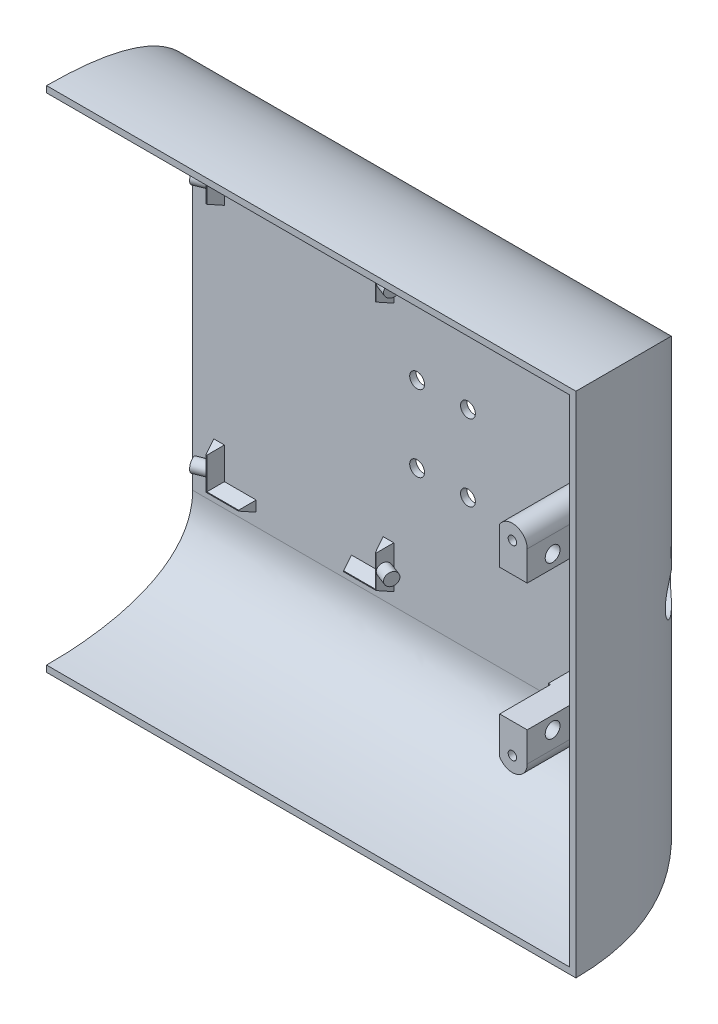
from build123d import *

# Parameters (mm, degrees)
BOSS_EXTRU_1_DEPTH           = 1.5
ENL_V_MAT_EXTRU_1_REACH      = 126.854
ESQUISSE3_R                  = 1.75
ESQUISSE4_W                  = 2.5
ESQUISSE4_H                  = 10
BOSS_EXTRU_2_DEPTH           = 3
BOSS_EXTRU_2_DRAFT           = -21
ESQUISSE4_W_2                = 10
ESQUISSE4_H_2                = 2.5
BOSS_EXTRU_2_PROFILE_2_DEPTH = 3
BOSS_EXTRU_2_PROFILE_2_DRAFT = -21
BOSS_EXTRU_2_PROFILE_3_DEPTH = 3
BOSS_EXTRU_2_PROFILE_3_DRAFT = -21
BOSS_EXTRU_2_PROFILE_4_DEPTH = 3
BOSS_EXTRU_2_PROFILE_4_DRAFT = -21
BOSS_EXTRU_2_PROFILE_5_DEPTH = 3
BOSS_EXTRU_2_PROFILE_5_DRAFT = -21
BOSS_EXTRU_2_PROFILE_6_DEPTH = 3
BOSS_EXTRU_2_PROFILE_6_DRAFT = -21
ENL_V_MAT_EXTRU_2_REACH      = 159.044
ESQUISSE8_R                  = 1
BOSS_EXTRU_3_REACH           = 159.044
ESQUISSE9_R                  = 1
ENL_V_MAT_EXTRU_3_DEPTH      = 12
ENL_V_MAT_EXTRU_4_REACH      = 148.818
ESQUISSE11_R                 = 1.75
BOSS_EXTRU_4_REACH           = 148.454
ESQUISSE16_W                 = 15
ESQUISSE16_H                 = 12
ENL_V_MAT_EXTRU_5_REACH      = 211.012
ESQUISSE12_R                 = 4.25
ESQUISSE17_W                 = 4
ESQUISSE17_H                 = 12
ENL_V_MAT_EXTRU_6_DEPTH      = 8
ESQUISSE20_R                 = 1.5
BOSS_EXTRU_5_DEPTH           = 3
ESQUISSE21_R                 = 1.5
BOSS_EXTRU_6_DEPTH           = 3


with BuildPart() as part:
    # Esquisse1 → Boss.-Extru.1 (new body)
    with BuildSketch(Plane.XY):
        Polygon((100.649081925, 73.864865318), (-4.350918075, 73.864865318), (-4.350918075, 33.864865318), (-4.350918075, -6.135134682), (100.649081925, -6.135134682), align=None)
    extrude(amount=BOSS_EXTRU_1_DEPTH)

    # Esquisse3 → Enlèv. mat.-Extru.1 (cut, up to next)
    with BuildSketch(Plane.XY.offset(1.5), mode=Mode.PRIVATE) as enl_v_mat_extru_1_sk1:
        with Locations((48.649081925, 42.864865318)):
            Circle(ESQUISSE3_R)
    enl_v_mat_extru_1_tool1 = extrude(enl_v_mat_extru_1_sk1.sketch, amount=-ENL_V_MAT_EXTRU_1_REACH, mode=Mode.PRIVATE) & part.part
    # Esquisse3 → Enlèv. mat.-Extru.1 (cut, up to next)
    with BuildSketch(Plane.XY.offset(1.5), mode=Mode.PRIVATE) as enl_v_mat_extru_1_sk2:
        with Locations((48.649081925, 24.864865318)):
            Circle(ESQUISSE3_R)
    enl_v_mat_extru_1_tool2 = extrude(enl_v_mat_extru_1_sk2.sketch, amount=-ENL_V_MAT_EXTRU_1_REACH, mode=Mode.PRIVATE) & part.part
    # Esquisse3 → Enlèv. mat.-Extru.1 (cut, up to next)
    with BuildSketch(Plane.XY.offset(1.5), mode=Mode.PRIVATE) as enl_v_mat_extru_1_sk3:
        with Locations((60.649081925, 24.864865318)):
            Circle(ESQUISSE3_R)
    enl_v_mat_extru_1_tool3 = extrude(enl_v_mat_extru_1_sk3.sketch, amount=-ENL_V_MAT_EXTRU_1_REACH, mode=Mode.PRIVATE) & part.part
    # Esquisse3 → Enlèv. mat.-Extru.1 (cut, up to next)
    with BuildSketch(Plane.XY.offset(1.5), mode=Mode.PRIVATE) as enl_v_mat_extru_1_sk4:
        with Locations((60.649081925, 42.864865318)):
            Circle(ESQUISSE3_R)
    enl_v_mat_extru_1_tool4 = extrude(enl_v_mat_extru_1_sk4.sketch, amount=-ENL_V_MAT_EXTRU_1_REACH, mode=Mode.PRIVATE) & part.part
    add(enl_v_mat_extru_1_tool1.solids().sort_by_distance((48.649082, 42.864865, 1.5))[0], mode=Mode.SUBTRACT)
    add(enl_v_mat_extru_1_tool2.solids().sort_by_distance((48.649082, 24.864865, 1.5))[0], mode=Mode.SUBTRACT)
    add(enl_v_mat_extru_1_tool3.solids().sort_by_distance((60.649082, 24.864865, 1.5))[0], mode=Mode.SUBTRACT)
    add(enl_v_mat_extru_1_tool4.solids().sort_by_distance((60.649082, 42.864865, 1.5))[0], mode=Mode.SUBTRACT)


with BuildPart() as boss_extru_2_tool:
    # Esquisse4 → Boss.-Extru.2 (with draft: the straight prism first)
    with BuildSketch(Plane(origin=(0, 0, 1.5), x_dir=(-1, 0, 0), z_dir=(0, 0, -1))):
        with Locations((-1.899081925, 60.864865318)):
            Rectangle(ESQUISSE4_W, ESQUISSE4_H)
    extrude(amount=-BOSS_EXTRU_2_DEPTH)
    # Boss.-Extru.2: the draft: its side faces are tilted about the plane it starts from
    boss_extru_2_sides = [boss_extru_2_tool.faces().sort_by_distance(p)[0] for p in [
        (3.149081925, 60.864865318, 3),
        (1.899081925, 55.864865318, 3),
        (0.649081925, 60.864865318, 3),
        (1.899081925, 65.864865318, 3),
    ]]
    draft(boss_extru_2_sides, Plane(origin=(0, 0, 1.5), x_dir=(-1, 0, 0), z_dir=(0, 0, -1)), BOSS_EXTRU_2_DRAFT)


with BuildPart() as part_1:
    add(part.part)

    # Boss.-Extru.2: add boss_extru_2_tool
    add(boss_extru_2_tool.part)


with BuildPart() as boss_extru_2_profile_2_tool:
    # Esquisse4 → Boss.-Extru.2 profile 2 (with draft: the straight prism first)
    with BuildSketch(Plane(origin=(0, 0, 1.5), x_dir=(-1, 0, 0), z_dir=(0, 0, -1))):
        with Locations((-10.649081925, 69.614865318)):
            Rectangle(ESQUISSE4_W_2, ESQUISSE4_H_2)
    extrude(amount=-BOSS_EXTRU_2_PROFILE_2_DEPTH)
    # Boss.-Extru.2 profile 2: the draft: its side faces are tilted about the plane it starts from
    boss_extru_2_profile_2_sides = [boss_extru_2_profile_2_tool.faces().sort_by_distance(p)[0] for p in [
        (10.649081925, 70.864865318, 3),
        (15.649081925, 69.614865318, 3),
        (10.649081925, 68.364865318, 3),
        (5.649081925, 69.614865318, 3),
    ]]
    draft(boss_extru_2_profile_2_sides, Plane(origin=(0, 0, 1.5), x_dir=(-1, 0, 0), z_dir=(0, 0, -1)), BOSS_EXTRU_2_PROFILE_2_DRAFT)


with BuildPart() as part_2:
    add(part_1.part)

    # Boss.-Extru.2 profile 2: add boss_extru_2_profile_2_tool
    add(boss_extru_2_profile_2_tool.part)


with BuildPart() as boss_extru_2_profile_3_tool:
    # Esquisse4 → Boss.-Extru.2 profile 3 (with draft: the straight prism first)
    with BuildSketch(Plane(origin=(0, 0, 1.5), x_dir=(-1, 0, 0), z_dir=(0, 0, -1))):
        with Locations((-41.899081925, 60.864865318)):
            Rectangle(ESQUISSE4_W, ESQUISSE4_H)
    extrude(amount=-BOSS_EXTRU_2_PROFILE_3_DEPTH)
    # Boss.-Extru.2 profile 3: the draft: its side faces are tilted about the plane it starts from
    boss_extru_2_profile_3_sides = [boss_extru_2_profile_3_tool.faces().sort_by_distance(p)[0] for p in [
        (41.899081925, 65.864865318, 3),
        (43.149081925, 60.864865318, 3),
        (41.899081925, 55.864865318, 3),
        (40.649081925, 60.864865318, 3),
    ]]
    draft(boss_extru_2_profile_3_sides, Plane(origin=(0, 0, 1.5), x_dir=(-1, 0, 0), z_dir=(0, 0, -1)), BOSS_EXTRU_2_PROFILE_3_DRAFT)


with BuildPart() as part_3:
    add(part_2.part)

    # Boss.-Extru.2 profile 3: add boss_extru_2_profile_3_tool
    add(boss_extru_2_profile_3_tool.part)


with BuildPart() as boss_extru_2_profile_4_tool:
    # Esquisse4 → Boss.-Extru.2 profile 4 (with draft: the straight prism first)
    with BuildSketch(Plane(origin=(0, 0, 1.5), x_dir=(-1, 0, 0), z_dir=(0, 0, -1))):
        with Locations((-33.149081925, 69.614865318)):
            Rectangle(ESQUISSE4_W_2, ESQUISSE4_H_2)
    extrude(amount=-BOSS_EXTRU_2_PROFILE_4_DEPTH)
    # Boss.-Extru.2 profile 4: the draft: its side faces are tilted about the plane it starts from
    boss_extru_2_profile_4_sides = [boss_extru_2_profile_4_tool.faces().sort_by_distance(p)[0] for p in [
        (38.149081925, 69.614865318, 3),
        (33.149081925, 68.364865318, 3),
        (28.149081925, 69.614865318, 3),
        (33.149081925, 70.864865318, 3),
    ]]
    draft(boss_extru_2_profile_4_sides, Plane(origin=(0, 0, 1.5), x_dir=(-1, 0, 0), z_dir=(0, 0, -1)), BOSS_EXTRU_2_PROFILE_4_DRAFT)


with BuildPart() as part_4:
    add(part_3.part)

    # Boss.-Extru.2 profile 4: add boss_extru_2_profile_4_tool
    add(boss_extru_2_profile_4_tool.part)


with BuildPart() as boss_extru_2_profile_5_tool:
    # Esquisse4 → Boss.-Extru.2 profile 5 (with draft: the straight prism first)
    with BuildSketch(Plane(origin=(0, 0, 1.5), x_dir=(-1, 0, 0), z_dir=(0, 0, -1))):
        Polygon((-40.649081925, 6.864865318), (-43.149081925, 6.864865318), (-43.149081925, -3.135134682), (-33.149081925, -3.135134682), (-33.149081925, -0.635134682), (-40.649081925, -0.635134682), align=None)
    extrude(amount=-BOSS_EXTRU_2_PROFILE_5_DEPTH)
    # Boss.-Extru.2 profile 5: the draft: its side faces are tilted about the plane it starts from
    boss_extru_2_profile_5_sides = [boss_extru_2_profile_5_tool.faces().sort_by_distance(p)[0] for p in [
        (41.899081925, 6.864865318, 3),
        (43.149081925, 1.864865318, 3),
        (38.149081925, -3.135134682, 3),
        (33.149081925, -1.885134682, 3),
        (36.899081925, -0.635134682, 3),
        (40.649081925, 3.114865318, 3),
    ]]
    draft(boss_extru_2_profile_5_sides, Plane(origin=(0, 0, 1.5), x_dir=(-1, 0, 0), z_dir=(0, 0, -1)), BOSS_EXTRU_2_PROFILE_5_DRAFT)


with BuildPart() as part_5:
    add(part_4.part)

    # Boss.-Extru.2 profile 5: add boss_extru_2_profile_5_tool
    add(boss_extru_2_profile_5_tool.part)


with BuildPart() as boss_extru_2_profile_6_tool:
    # Esquisse4 → Boss.-Extru.2 profile 6 (with draft: the straight prism first)
    with BuildSketch(Plane(origin=(0, 0, 1.5), x_dir=(-1, 0, 0), z_dir=(0, 0, -1))):
        Polygon((-10.649081925, -0.635134682), (-10.649081925, -3.135134682), (-0.649081925, -3.135134682), (-0.649081925, 6.864865318), (-3.149081925, 6.864865318), (-3.149081925, -0.635134682), align=None)
    extrude(amount=-BOSS_EXTRU_2_PROFILE_6_DEPTH)
    # Boss.-Extru.2 profile 6: the draft: its side faces are tilted about the plane it starts from
    boss_extru_2_profile_6_sides = [boss_extru_2_profile_6_tool.faces().sort_by_distance(p)[0] for p in [
        (10.649081925, -1.885134682, 3),
        (5.649081925, -3.135134682, 3),
        (0.649081925, 1.864865318, 3),
        (1.899081925, 6.864865318, 3),
        (3.149081925, 3.114865318, 3),
        (6.899081925, -0.635134682, 3),
    ]]
    draft(boss_extru_2_profile_6_sides, Plane(origin=(0, 0, 1.5), x_dir=(-1, 0, 0), z_dir=(0, 0, -1)), BOSS_EXTRU_2_PROFILE_6_DRAFT)


with BuildPart() as part_6:
    add(part_5.part)

    # Boss.-Extru.2 profile 6: add boss_extru_2_profile_6_tool
    add(boss_extru_2_profile_6_tool.part)

    # Balayage1: sweep along a path in Esquisse19
    with BuildLine(Plane(origin=(0, 0, 0), x_dir=(-1, 0, 0), z_dir=(0, 0, -1))) as balayage1_path:
        Line((4.350918075, -6.135134682), (-100.649081925, -6.135134682))
        Line((-100.649081925, -6.135134682), (-100.649081925, 73.864865318))
        Line((-100.649081925, 73.864865318), (4.350918075, 73.864865318))
    # Esquisse7 → Balayage1 (sweep)
    with BuildSketch(Plane(origin=(-4.350918075, 0, 0), x_dir=(0, 0, -1), z_dir=(1, 0, 0))):
        with BuildLine():
            Line((-1.5, 73.864865318), (0, 73.864865318))
            add(Edge.make_bspline(
                [(0, 73.864865318), (0, 81.337787028), (-5.099638508, 93.803150825), (-36, 93.864865318)],
                knots=[0, 0, 0, 0, 1, 1, 1, 1], degree=3))
            Line((-36, 93.864865318), (-36, 92.364865318))
            add(Edge.make_bspline(
                [(-36, 92.364865318), (-32.824934583, 92.364865318), (-1.5, 92.909703572), (-1.5, 73.864865318)],
                knots=[0, 0, 0, 0, 1, 1, 1, 1], degree=3))
        make_face()
    sweep(path=balayage1_path.line, transition=Transition.RIGHT)

    # Esquisse8 → Enlèv. mat.-Extru.2 (cut, up to next)
    with BuildSketch(Plane(origin=(0, 0, 0), x_dir=(-1, 0, 0), z_dir=(0, 0, -1)), mode=Mode.PRIVATE) as enl_v_mat_extru_2_sk1:
        with Locations((-105.649081925, 55.864865318)):
            Circle(ESQUISSE8_R)
    enl_v_mat_extru_2_tool1 = extrude(enl_v_mat_extru_2_sk1.sketch, amount=-ENL_V_MAT_EXTRU_2_REACH, mode=Mode.PRIVATE) & part_6.part
    # Esquisse8 → Enlèv. mat.-Extru.2 (cut, up to next)
    with BuildSketch(Plane(origin=(0, 0, 0), x_dir=(-1, 0, 0), z_dir=(0, 0, -1)), mode=Mode.PRIVATE) as enl_v_mat_extru_2_sk2:
        with Locations((-105.649081925, 11.864865318)):
            Circle(ESQUISSE8_R)
    enl_v_mat_extru_2_tool2 = extrude(enl_v_mat_extru_2_sk2.sketch, amount=-ENL_V_MAT_EXTRU_2_REACH, mode=Mode.PRIVATE) & part_6.part
    add(enl_v_mat_extru_2_tool1.solids().sort_by_distance((105.649082, 55.864865, 0))[0], mode=Mode.SUBTRACT)
    add(enl_v_mat_extru_2_tool2.solids().sort_by_distance((105.649082, 11.864865, 0))[0], mode=Mode.SUBTRACT)

    # Esquisse9 → Boss.-Extru.3 (add, up to next)
    with BuildSketch(Plane.XY.offset(36), mode=Mode.PRIVATE) as boss_extru_3_sk1:
        with BuildLine():
            Line((102.149081925, 55.864865318), (102.149081925, 48.864865318))
            Line((102.149081925, 48.864865318), (109.149081925, 48.864865318))
            Line((109.149081925, 48.864865318), (109.149081925, 55.864865318))
            ThreePointArc((109.149081925, 55.864865318), (105.649081925, 59.364865318), (102.149081925, 55.864865318))
        make_face()
        with Locations((105.649081925, 55.864865318)):
            Circle(ESQUISSE9_R, mode=Mode.SUBTRACT)
    boss_extru_3_tool1 = extrude(boss_extru_3_sk1.sketch, amount=-BOSS_EXTRU_3_REACH, mode=Mode.PRIVATE) - part_6.part
    # Esquisse9 → Boss.-Extru.3 (add, up to next)
    with BuildSketch(Plane.XY.offset(36), mode=Mode.PRIVATE) as boss_extru_3_sk2:
        with BuildLine():
            Line((109.149081925, 11.864865318), (109.149081925, 18.864865318))
            Line((109.149081925, 18.864865318), (102.149081925, 18.864865318))
            Line((102.149081925, 18.864865318), (102.149081925, 11.864865318))
            ThreePointArc((102.149081925, 11.864865318), (105.649081925, 8.364865318), (109.149081925, 11.864865318))
        make_face()
        with Locations((105.649081925, 11.864865318)):
            Circle(ESQUISSE9_R, mode=Mode.SUBTRACT)
    boss_extru_3_tool2 = extrude(boss_extru_3_sk2.sketch, amount=-BOSS_EXTRU_3_REACH, mode=Mode.PRIVATE) - part_6.part
    add(boss_extru_3_tool1.solids().sort_by_distance((105.649082, 53.669547, 36))[0])
    add(boss_extru_3_tool2.solids().sort_by_distance((105.649082, 14.060183, 36))[0])

    # Esquisse10 → Enlèv. mat.-Extru.3 (cut)
    with BuildSketch(Plane.XY.offset(36)):
        with BuildLine():
            Line((102.649081925, 10.06208968), (102.649081925, 18.864865318))
            Line((102.649081925, 18.864865318), (102.149081925, 18.864865318))
            Line((102.149081925, 18.864865318), (102.149081925, 11.864865318))
            ThreePointArc((102.149081925, 11.864865318), (102.276397535, 10.929450971), (102.649081925, 10.06208968))
        make_face()
        with BuildLine():
            Line((102.649081925, 48.864865318), (102.649081925, 57.667640956))
            ThreePointArc((102.649081925, 57.667640956), (102.276397535, 56.800279665), (102.149081925, 55.864865318))
            Line((102.149081925, 55.864865318), (102.149081925, 48.864865318))
            Line((102.149081925, 48.864865318), (102.649081925, 48.864865318))
        make_face()
    extrude(amount=-ENL_V_MAT_EXTRU_3_DEPTH, mode=Mode.SUBTRACT)

    # Esquisse11 → Enlèv. mat.-Extru.4 (cut, up to next)
    with BuildSketch(Plane.ZY.offset(-102.649081925), mode=Mode.PRIVATE) as enl_v_mat_extru_4_sk1:
        with Locations((30, 51.864865318)):
            Circle(ESQUISSE11_R)
    enl_v_mat_extru_4_tool1 = extrude(enl_v_mat_extru_4_sk1.sketch, amount=-ENL_V_MAT_EXTRU_4_REACH, mode=Mode.PRIVATE) & part_6.part
    # Esquisse11 → Enlèv. mat.-Extru.4 (cut, up to next)
    with BuildSketch(Plane.ZY.offset(-102.649081925), mode=Mode.PRIVATE) as enl_v_mat_extru_4_sk2:
        with Locations((30, 15.864865318)):
            Circle(ESQUISSE11_R)
    enl_v_mat_extru_4_tool2 = extrude(enl_v_mat_extru_4_sk2.sketch, amount=-ENL_V_MAT_EXTRU_4_REACH, mode=Mode.PRIVATE) & part_6.part
    add(enl_v_mat_extru_4_tool1.solids().sort_by_distance((102.649082, 51.864865, 30))[0], mode=Mode.SUBTRACT)
    add(enl_v_mat_extru_4_tool2.solids().sort_by_distance((102.649082, 15.864865, 30))[0], mode=Mode.SUBTRACT)

    # Esquisse16 → Boss.-Extru.4 (add, up to next)
    with BuildSketch(Plane.ZY.offset(-102.149081925), mode=Mode.PRIVATE) as boss_extru_4_sk1:
        with Locations((9.067319999, 33.864865318)):
            Rectangle(ESQUISSE16_W, ESQUISSE16_H)
    boss_extru_4_tool1 = extrude(boss_extru_4_sk1.sketch, amount=-BOSS_EXTRU_4_REACH, mode=Mode.PRIVATE) - part_6.part
    add(boss_extru_4_tool1.solids().sort_by_distance((102.149082, 33.864865, 9.06732))[0])

    # Enlèv. mat.-Extru.5: up to this plane
    enl_v_mat_extru_5_end = Plane(origin=(102.149081925, 0, 0), z_dir=(-1, 0, 0))
    # Esquisse12 → Enlèv. mat.-Extru.5 (cut, up to the surface)
    with BuildSketch(Plane(origin=(157.424011878, 0, -57.297654482), x_dir=(-0.34202014332566427, 0, -0.93969262078591), z_dir=(0.93969262078591, -1.2457869471927707e-15, -0.34202014332566427)), mode=Mode.PRIVATE) as enl_v_mat_extru_5_sk1:
        with Locations((-44.71825261, 33.864865318)):
            Circle(ESQUISSE12_R)
    enl_v_mat_extru_5_tool1 = split(extrude(enl_v_mat_extru_5_sk1.sketch, amount=-ENL_V_MAT_EXTRU_5_REACH, mode=Mode.PRIVATE), bisect_by=enl_v_mat_extru_5_end, keep=Keep.BOTH, mode=Mode.PRIVATE)
    add(enl_v_mat_extru_5_tool1.solids().sort_by_distance((172.718555, 33.864865, -15.276242))[0], mode=Mode.SUBTRACT)

    # Esquisse17 → Enlèv. mat.-Extru.6 (cut)
    with BuildSketch(Plane.XY.offset(16.567319999)):
        with Locations((109.149081925, 33.864865318)):
            Rectangle(ESQUISSE17_W, ESQUISSE17_H)
    extrude(amount=-ENL_V_MAT_EXTRU_6_DEPTH, mode=Mode.SUBTRACT)

    # Esquisse20 → Boss.-Extru.5 (add)
    with BuildSketch(Plane(origin=(0.063873945, 0, -0.02451891), x_dir=(0.3583679495453005, 0, 0.9335804264972016), z_dir=(-0.9335804264972016, 0, 0.3583679495453005))):
        with Locations((3.346415779, 60.864865318)):
            Circle(ESQUISSE20_R)
        with Locations((3.346415779, 1.864865318)):
            Circle(ESQUISSE20_R)
    extrude(amount=BOSS_EXTRU_5_DEPTH)

    # Esquisse21 → Boss.-Extru.6 (add)
    with BuildSketch(Plane(origin=(38.109397396, 0, 14.628827057), x_dir=(0.3583679495453005, 0, -0.9335804264972016), z_dir=(0.9335804264972016, 0, 0.3583679495453005))):
        with Locations((12.349442394, 60.864865318)):
            Circle(ESQUISSE21_R)
        with Locations((12.349442394, 1.864865318)):
            Circle(ESQUISSE21_R)
    extrude(amount=BOSS_EXTRU_6_DEPTH)


solid = part_6.part
